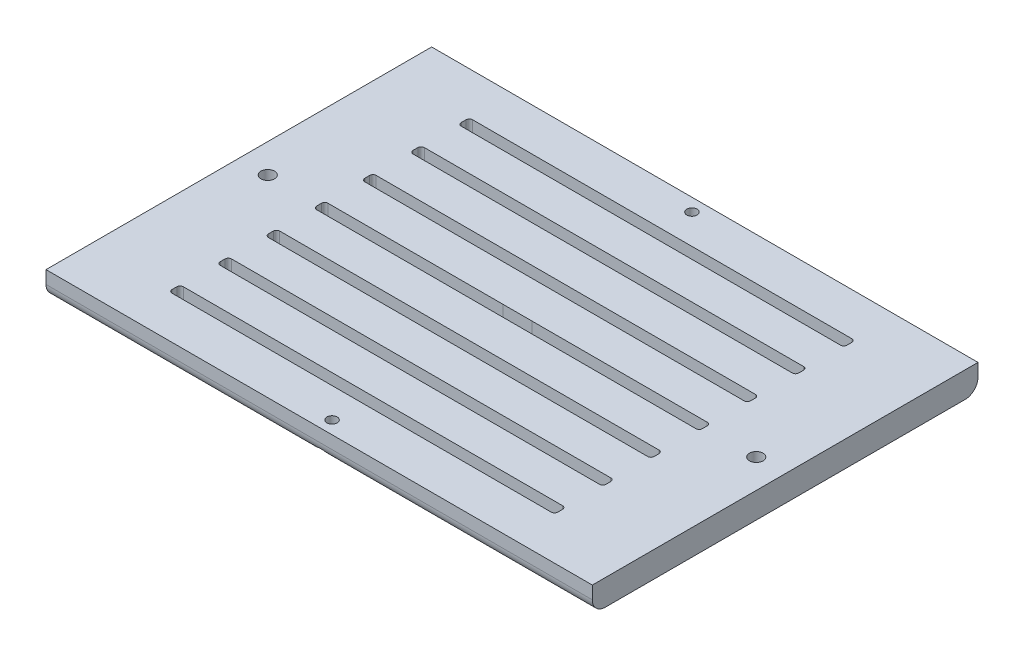
from build123d import *

# Parameters (mm, degrees)
IZIM1_W                     = 170
IZIM1_H                     = 8
Y_KSEKLIK_EKSTR_ZYON1_DEPTH = 60
IZIM2_R                     = 1.6
IZIM2_R_2                   = 2.1
KES_EKSTR_ZYON1_DEPTH       = 5
IZIM3_R                     = 3.4
KES_EKSTR_ZYON2_DEPTH       = 2.7
IZIM4_R                     = 4.4
KES_EKSTR_ZYON3_DEPTH       = 3.5
RADYUS1_R                   = 4
KES_EKSTR_ZYON4_DEPTH       = 10


with BuildPart() as part:
    # Çizim1 → Yükseklik-Ekstrüzyon1 (new, symmetric)
    with BuildSketch(Plane.XY):
        Rectangle(IZIM1_W, IZIM1_H)
    extrude(amount=Y_KSEKLIK_EKSTR_ZYON1_DEPTH, both=True)

    # Çizim2 → Kes-Ekstrüzyon1 (cut, symmetric)
    with BuildSketch(Plane(origin=(0, 0, 0), x_dir=(1, 0, 0), z_dir=(0, 1, 0))):
        with Locations(Location((0, 56, 0), (0, 0, 270))):
            Circle(IZIM2_R)
        with Locations(Location((0, -56, 0), (0, 0, 270))):
            Circle(IZIM2_R)
        with Locations(Location((-76, 0, 0), (0, 0, 270))):
            Circle(IZIM2_R_2)
        with Locations(Location((76, 0, 0), (0, 0, 270))):
            Circle(IZIM2_R_2)
    extrude(amount=KES_EKSTR_ZYON1_DEPTH, both=True, mode=Mode.SUBTRACT)

    # Çizim3 → Kes-Ekstrüzyon2 (cut)
    with BuildSketch(Plane.XZ.offset(4)):
        with Locations(Location((0, -56, 0), (0, 0, 270))):
            Circle(IZIM3_R)
        with Locations(Location((0, 56, 0), (0, 0, 270))):
            Circle(IZIM3_R)
    extrude(amount=-KES_EKSTR_ZYON2_DEPTH, mode=Mode.SUBTRACT)

    # Çizim4 → Kes-Ekstrüzyon3 (cut)
    with BuildSketch(Plane.XZ.offset(4)):
        with Locations(Location((-76, 0, 0), (0, 0, 270))):
            Circle(IZIM4_R)
        with Locations(Location((76, 0, 0), (0, 0, 270))):
            Circle(IZIM4_R)
    extrude(amount=-KES_EKSTR_ZYON3_DEPTH, mode=Mode.SUBTRACT)

    # Radyus1
    # the kernel refuses this fillet: 4 mm, written as the material it takes off along each edge
    with BuildSketch(Plane(origin=(-95, -4, 60), x_dir=(0, 0, -1), z_dir=(1, 0, 0))) as radyus1_piece_1:
        with BuildLine():
            CenterArc((RADYUS1_R, RADYUS1_R), RADYUS1_R, 180, 90)
            Line((0, RADYUS1_R), (0, 0))
            Line((0, 0), (RADYUS1_R, 0))
        make_face()
    extrude(amount=190, mode=Mode.SUBTRACT)
    with BuildSketch(Plane(origin=(-95, -4, -60), x_dir=(0, 0, 1), z_dir=(1, 0, 0))) as radyus1_piece_2:
        with BuildLine():
            CenterArc((RADYUS1_R, -RADYUS1_R), RADYUS1_R, 90, 90)
            Line((0, -RADYUS1_R), (0, 0))
            Line((0, 0), (RADYUS1_R, 0))
        make_face()
    extrude(amount=190, mode=Mode.SUBTRACT)

    # Çizim6 → Kes-Ekstrüzyon4 (cut, symmetric)
    with BuildSketch(Plane(origin=(0, 0, 0), x_dir=(1, 0, 0), z_dir=(0, 1, 0))):
        with BuildLine():
            Line((4.5, -43.24922609), (58.973465944, -43.24922609))
            ThreePointArc((58.973465944, -43.24922609), (59.680572726, -43.542119309), (59.973465944, -44.24922609))
            Line((59.973465944, -44.24922609), (59.973465944, -45.74922609))
            ThreePointArc((59.973465944, -45.74922609), (59.680572726, -46.456332871), (58.973465944, -46.74922609))
            Line((58.973465944, -46.74922609), (-59.026534056, -46.74922609))
            ThreePointArc((-59.026534056, -46.74922609), (-59.733640837, -46.456332871), (-60.026534056, -45.74922609))
            Line((-60.026534056, -45.74922609), (-60.026534056, -44.24922609))
            ThreePointArc((-60.026534056, -44.24922609), (-59.733640837, -43.542119309), (-59.026534056, -43.24922609))
            Line((-59.026534056, -43.24922609), (-4.5, -43.24922609))
            Line((-4.5, -43.24922609), (4.5, -43.24922609))
        make_face()
        with BuildLine():
            Line((-59.026534056, -1.74922609), (-4.5, -1.74922609))
            Line((-4.5, -1.74922609), (4.5, -1.74922609))
            Line((4.5, -1.74922609), (58.973465944, -1.74922609))
            ThreePointArc((58.973465944, -1.74922609), (59.680572726, -1.456332871), (59.973465944, -0.74922609))
            Line((59.973465944, -0.74922609), (59.973465944, 0.747733475))
            ThreePointArc((59.973465944, 0.747733475), (59.68059176, 1.454821222), (58.973519783, 1.747733474))
            Line((58.973519783, 1.747733474), (4.499892323, 1.750666239))
            Line((4.499892323, 1.750666239), (-4.5, 1.75077391))
            Line((-4.5, 1.75077391), (-59.026534056, 1.75077391))
            ThreePointArc((-59.026534056, 1.75077391), (-59.733640837, 1.457880691), (-60.026534056, 0.75077391))
            Line((-60.026534056, 0.75077391), (-60.026534056, -0.74922609))
            ThreePointArc((-60.026534056, -0.74922609), (-59.733640837, -1.456332871), (-59.026534056, -1.74922609))
        make_face()
        with BuildLine():
            Line((4.5, -28.24922609), (58.973465944, -28.24922609))
            ThreePointArc((58.973465944, -28.24922609), (59.680572726, -28.542119309), (59.973465944, -29.24922609))
            Line((59.973465944, -29.24922609), (59.973465944, -30.74922609))
            ThreePointArc((59.973465944, -30.74922609), (59.680572726, -31.456332871), (58.973465944, -31.74922609))
            Line((58.973465944, -31.74922609), (4.5, -31.74922609))
            Line((4.5, -31.74922609), (-4.5, -31.74922609))
            Line((-4.5, -31.74922609), (-59.026534056, -31.74922609))
            ThreePointArc((-59.026534056, -31.74922609), (-59.733640837, -31.456332871), (-60.026534056, -30.74922609))
            Line((-60.026534056, -30.74922609), (-60.026534056, -29.24922609))
            ThreePointArc((-60.026534056, -29.24922609), (-59.733640837, -28.542119309), (-59.026534056, -28.24922609))
            Line((-59.026534056, -28.24922609), (-4.5, -28.24922609))
            Line((-4.5, -28.24922609), (4.5, -28.24922609))
        make_face()
        with BuildLine():
            Line((-60.026534056, 14.25077391), (-60.026534056, 15.75077391))
            ThreePointArc((-60.026534056, 15.75077391), (-59.733640837, 16.457880691), (-59.026534056, 16.75077391))
            Line((-59.026534056, 16.75077391), (-4.5, 16.75077391))
            Line((-4.5, 16.75077391), (4.5, 16.75077391))
            Line((4.5, 16.75077391), (58.973465944, 16.75077391))
            ThreePointArc((58.973465944, 16.75077391), (59.680572726, 16.457880691), (59.973465944, 15.75077391))
            Line((59.973465944, 15.75077391), (59.973465944, 14.25077391))
            ThreePointArc((59.973465944, 14.25077391), (59.680572726, 13.543667129), (58.973465944, 13.25077391))
            Line((58.973465944, 13.25077391), (4.5, 13.25077391))
            Line((4.5, 13.25077391), (-4.5, 13.25077391))
            Line((-4.5, 13.25077391), (-59.026534056, 13.25077391))
            ThreePointArc((-59.026534056, 13.25077391), (-59.733640837, 13.543667129), (-60.026534056, 14.25077391))
        make_face()
        with BuildLine():
            Line((-60.026534056, 29.25077391), (-60.026534056, 30.75077391))
            ThreePointArc((-60.026534056, 30.75077391), (-59.733640837, 31.457880691), (-59.026534056, 31.75077391))
            Line((-59.026534056, 31.75077391), (-4.5, 31.75077391))
            Line((-4.5, 31.75077391), (4.5, 31.75077391))
            Line((4.5, 31.75077391), (58.973465944, 31.75077391))
            ThreePointArc((58.973465944, 31.75077391), (59.680572726, 31.457880691), (59.973465944, 30.75077391))
            Line((59.973465944, 30.75077391), (59.973465944, 29.25077391))
            ThreePointArc((59.973465944, 29.25077391), (59.680572726, 28.543667129), (58.973465944, 28.25077391))
            Line((58.973465944, 28.25077391), (4.5, 28.25077391))
            Line((4.5, 28.25077391), (-4.5, 28.25077391))
            Line((-4.5, 28.25077391), (-59.026534056, 28.25077391))
            ThreePointArc((-59.026534056, 28.25077391), (-59.733640837, 28.543667129), (-60.026534056, 29.25077391))
        make_face()
        with BuildLine():
            Line((-60.026534056, 44.25077391), (-60.026534056, 45.75077391))
            ThreePointArc((-60.026534056, 45.75077391), (-59.733640837, 46.457880691), (-59.026534056, 46.75077391))
            Line((-59.026534056, 46.75077391), (58.973465944, 46.75077391))
            ThreePointArc((58.973465944, 46.75077391), (59.680572726, 46.457880691), (59.973465944, 45.75077391))
            Line((59.973465944, 45.75077391), (59.973465944, 44.25077391))
            ThreePointArc((59.973465944, 44.25077391), (59.680572726, 43.543667129), (58.973465944, 43.25077391))
            Line((58.973465944, 43.25077391), (4.5, 43.25077391))
            Line((4.5, 43.25077391), (-4.5, 43.25077391))
            Line((-4.5, 43.25077391), (-59.026534056, 43.25077391))
            ThreePointArc((-59.026534056, 43.25077391), (-59.733640837, 43.543667129), (-60.026534056, 44.25077391))
        make_face()
        with BuildLine():
            Line((-60.026534056, -15.74922609), (-60.026534056, -14.24922609))
            ThreePointArc((-60.026534056, -14.24922609), (-59.733640837, -13.542119309), (-59.026534056, -13.24922609))
            Line((-59.026534056, -13.24922609), (-4.5, -13.24922609))
            Line((-4.5, -13.24922609), (4.5, -13.24922609))
            Line((4.5, -13.24922609), (58.973465944, -13.24922609))
            ThreePointArc((58.973465944, -13.24922609), (59.680572726, -13.542119309), (59.973465944, -14.24922609))
            Line((59.973465944, -14.24922609), (59.973465944, -15.74922609))
            ThreePointArc((59.973465944, -15.74922609), (59.680572726, -16.456332871), (58.973465944, -16.74922609))
            Line((58.973465944, -16.74922609), (4.5, -16.74922609))
            Line((4.5, -16.74922609), (-4.5, -16.74922609))
            Line((-4.5, -16.74922609), (-59.026534056, -16.74922609))
            ThreePointArc((-59.026534056, -16.74922609), (-59.733640837, -16.456332871), (-60.026534056, -15.74922609))
        make_face()
    extrude(amount=KES_EKSTR_ZYON4_DEPTH, both=True, mode=Mode.SUBTRACT)


solid = part.part
